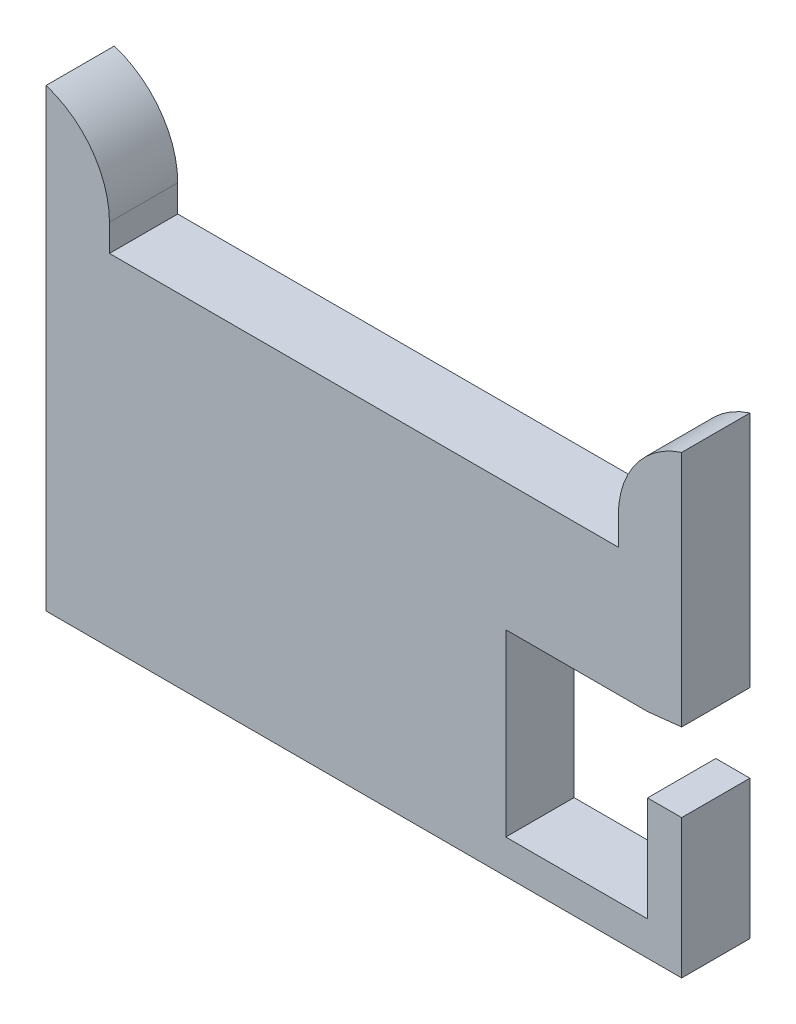
from build123d import *

# Parameters (mm, degrees)
BOSS_EXTRUDE1_DEPTH     = 6
FILLET7_R               = 8
FILLET8_R               = 8
SKETCH3_W               = 12.456838911
SKETCH3_H               = 15.77867169
CUT_EXTRUDE1_DEPTH      = 47.440976911
CUT_EXTRUDE2_DEPTH      = 47.440976911
CUT_EXTRUDE2_DEPTH_BACK = 47.440976911


with BuildPart() as part:
    # Sketch1 → Boss-Extrude1 (new body)
    with BuildSketch(Plane.XY):
        Polygon((-27.927868544, -36.616915423), (27.927868544, -36.616915423), (27.927868544, 3.383084577), (22.35572924, 3.383084577), (22.35572924, -6.616915423), (-22.35572924, -6.616915423), (-22.35572924, 3.383084577), (-27.927868544, 3.383084577), align=None)
    extrude(amount=BOSS_EXTRUDE1_DEPTH)

    # Fillet7
    # the kernel refuses this fillet: 8 mm, written as the material it takes off along each edge
    with BuildSketch(Plane(origin=(-22.35572924, 3.383084577, -19.056739693), x_dir=(0, -1, 0), z_dir=(0, 0, 1))) as fillet7_piece_1:
        with BuildLine():
            CenterArc((7.622695877, -8), FILLET7_R, 90, 72.333104018)
            Line((0, -5.572139303), (-0.152453918, -5.52358209))
            ThreePointArc((-0.152453918, -5.52358209), (-0.16, -2.786069652), (-0.16, 0))
            Line((-0.16, 0), (0, 0.16))
            Line((0, 0.16), (7.622695877, 0.16))
            Line((7.622695877, 0.16), (7.622695877, 0))
        make_face()
    extrude(amount=44.113479387, mode=Mode.SUBTRACT)

    # Fillet8
    # the kernel refuses this fillet: 8 mm, written as the material it takes off along each edge
    with BuildSketch(Plane(origin=(22.35572924, 3.383084577, -19.056739693), x_dir=(1, 0, 0), z_dir=(0, 0, 1))) as fillet8_piece_1:
        with BuildLine():
            CenterArc((8, -7.622695877), FILLET8_R, 107.666895982, 72.333104018)
            Line((0, -7.622695877), (-0.16, -7.622695877))
            Line((-0.16, -7.622695877), (-0.16, 0))
            Line((-0.16, 0), (0, 0.16))
            ThreePointArc((0, 0.16), (2.786069652, 0.16), (5.52358209, 0.152453918))
            Line((5.52358209, 0.152453918), (5.572139303, 0))
        make_face()
    extrude(amount=44.113479387, mode=Mode.SUBTRACT)

    # Sketch3 → Cut-Extrude1 (cut, through all)
    with BuildSketch(Plane.XY.offset(6)):
        with Locations((18.699449089, -25.727579578)):
            Rectangle(SKETCH3_W, SKETCH3_H)
    extrude(amount=-CUT_EXTRUDE1_DEPTH, mode=Mode.SUBTRACT)

    # Sketch4 → Cut-Extrude2 (cut, two sides: drawn at the far end of the back side and taken through both)
    with BuildSketch(Plane.XY.offset(6).offset(-CUT_EXTRUDE2_DEPTH_BACK)):
        Polygon((161.938614763, -3.164665246), (27.927868544, -17.516949699), (24.927868544, -17.838243733), (24.927868544, -24.410226663), (27.927868544, -24.410226663), (162.70497406, -24.410226663), (432.083990377, -14.69332112), (431.317631081, 6.552240297), align=None)
    extrude(amount=CUT_EXTRUDE2_DEPTH + CUT_EXTRUDE2_DEPTH_BACK, mode=Mode.SUBTRACT)


solid = part.part
